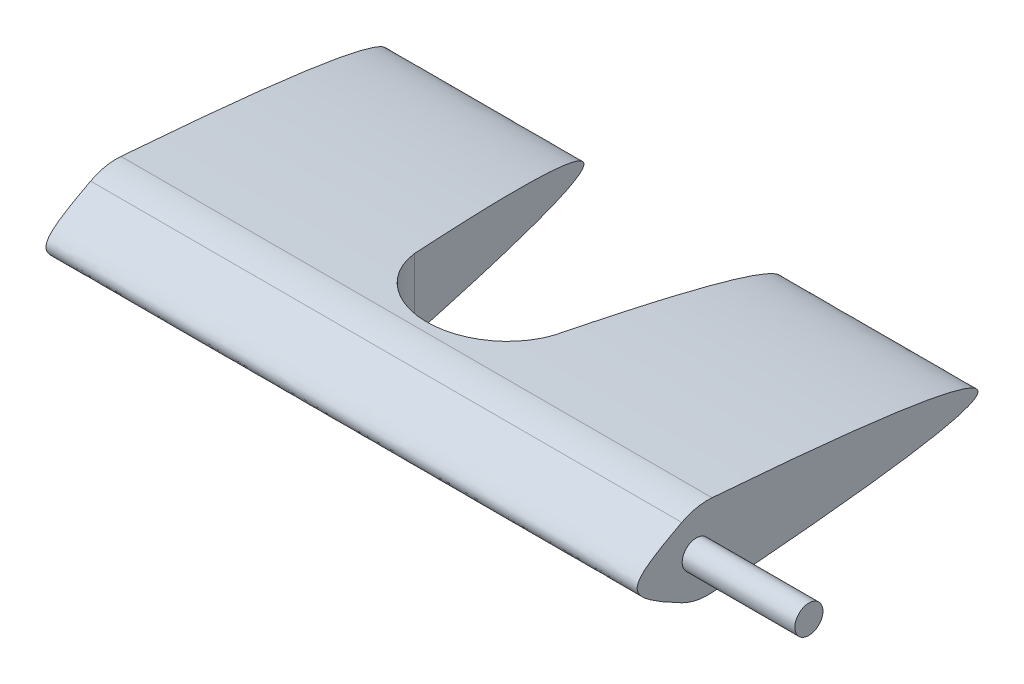
from build123d import *

# Parameters (mm, degrees)
SKETCH1_R               = 1.5
BOSS_EXTRUDE1_DEPTH     = 105
FILLET1_R               = 10
CUT_EXTRUDE1_DEPTH      = 117.542660484
CUT_EXTRUDE1_DEPTH_BACK = 117.542660484
CAVITY1_DEPTH           = 3
SKETCH3_R               = 2.5
SKETCH3_R_2             = 1.5
BOSS_EXTRUDE2_DEPTH     = 20
BOSS_EXTRUDE3_REACH     = 134.065
SKETCH4_R               = 1.5
CUT_EXTRUDE2_DEPTH      = 135.841357497
CUT_EXTRUDE2_DEPTH_BACK = 135.841357497
FILLET2_R               = 5
CUT_EXTRUDE3_DEPTH      = 10


# Read off the part's stored shape, not the designer's step: Cavity1
with BuildPart() as part:
    # Sketch1 → Boss-Extrude1 (new body)
    with BuildSketch(Plane(origin=(0, 0, 0), x_dir=(0, 0, -1), z_dir=(1, 0, 0))):
        with BuildLine():
            add(Edge.make_bspline(
                [(3.73e-07, 7.5), (-15, 0), (-3.73e-07, -7.5)],
                knots=[0, 0, 0, 1, 1, 1], degree=2, weights=[1, 2.333333333, 1]))
            add(Edge.make_bspline(
                [(3.73e-07, 7.5), (100, 0), (-3.73e-07, -7.5)],
                knots=[0, 0, 0, 1, 1, 1], degree=2, weights=[1, 1.001467765, 1]))
        make_face()
        Circle(SKETCH1_R, mode=Mode.SUBTRACT)
    extrude(amount=BOSS_EXTRUDE1_DEPTH)

    # Fillet1
    fillet1_edges = [part.edges().sort_by_distance(p)[0] for p in [
        (52.5, -7.5, 3.73e-07),
        (52.5, 7.5, -3.73e-07),
    ]]
    fillet(fillet1_edges, radius=FILLET1_R)

    # Sketch2 → Cut-Extrude1 (cut, two sides: drawn at the far end of the back side and taken through both)
    with BuildSketch(Plane(origin=(0, 0, 0), x_dir=(1, 0, 0), z_dir=(0, 1, 0)).offset(-CUT_EXTRUDE1_DEPTH_BACK)):
        with BuildLine():
            Line((65, 19.76833361), (65, 24.578179161))
            ThreePointArc((65, 24.578179161), (52.5, 34.902500415), (40, 24.578179161))
            Line((40, 24.578179161), (40, 19.76833361))
            Line((40, 19.76833361), (40, 14.958488059))
            ThreePointArc((40, 14.958488059), (52.5, 4.634166805), (65, 14.958488059))
            Line((65, 14.958488059), (65, 19.76833361))
        make_face()
        with BuildLine():
            Line((65, 24.578179161), (65, 50.03666722))
            Line((65, 50.03666722), (40, 50.03666722))
            Line((40, 50.03666722), (40, 24.578179161))
            ThreePointArc((40, 24.578179161), (52.5, 34.902500415), (65, 24.578179161))
        make_face()
    extrude(amount=CUT_EXTRUDE1_DEPTH + CUT_EXTRUDE1_DEPTH_BACK, mode=Mode.SUBTRACT)

    # Cavity1 outline → Cavity1 (cut)
    with BuildSketch(Plane.YZ):
        with BuildLine():
            ThreePointArc((-2, -13.75), (0, -15.75), (2, -13.75))
            Line((2, -13.75), (2.497863905, -2.796994085))
            ThreePointArc((2.497863905, -2.796994085), (0, 3.75), (-2.497863905, -2.796994085))
            Line((-2.497863905, -2.796994085), (-2, -13.75))
        make_face()
    extrude(amount=CAVITY1_DEPTH, mode=Mode.SUBTRACT)

    # Sketch3 → Boss-Extrude2 (add)
    # profile 1 of 2: a face of its own
    with BuildSketch(Plane(origin=(105, 0, 0), x_dir=(0, 0, -1), z_dir=(1, 0, 0))):
        Circle(SKETCH3_R)
        with Locations(Location((0, 0, 0), (0, 0, 180))):
            Circle(SKETCH3_R_2, mode=Mode.SUBTRACT)
    # profile 2 of 2: a face of its own
    with BuildSketch(Plane(origin=(105, 0, 0), x_dir=(0, 0, -1), z_dir=(1, 0, 0))):
        with Locations(Location((0, 0, 0), (0, 0, 180))):
            Circle(SKETCH3_R_2)
    extrude(amount=BOSS_EXTRUDE2_DEPTH)

    # Sketch4 → Boss-Extrude3 (add, up to next)
    with BuildSketch(Plane.ZY.offset(-3), mode=Mode.PRIVATE) as boss_extrude3_sk1:
        Circle(SKETCH4_R)
    boss_extrude3_tool1 = extrude(boss_extrude3_sk1.sketch, amount=-BOSS_EXTRUDE3_REACH, mode=Mode.PRIVATE) - part.part
    add(boss_extrude3_tool1.solids().sort_by_distance((3, 0, 0))[0])

    # Sketch5 → Cut-Extrude2 (cut, two sides: drawn at the far end of the back side and taken through both)
    with BuildSketch(Plane(origin=(0, 0, 0), x_dir=(1, 0, 0), z_dir=(0, 1, 0)).offset(-CUT_EXTRUDE2_DEPTH_BACK)):
        Polygon((40, 14.958488059), (35, 50.03666722), (40, 50.03666722), align=None)
        Polygon((65, 50.03666722), (70, 50.03666722), (65, 14.958488059), align=None)
    extrude(amount=CUT_EXTRUDE2_DEPTH + CUT_EXTRUDE2_DEPTH_BACK, mode=Mode.SUBTRACT)

    # Fillet2
    fillet2_edges = [part.edges().sort_by_distance(p)[0] for p in [
        (1.5, 2.497863905, -2.796994085),
        (1.5, -2.497863905, -2.796994085),
    ]]
    fillet(fillet2_edges, radius=FILLET2_R)

    # Sketch7 → Cut-Extrude3 (cut)
    with BuildSketch(Plane.ZY.offset(-3)):
        with BuildLine():
            Line((-13.754651281, -2.199995083), (-4.420599378, -2.62427017))
            ThreePointArc((-4.420599378, -2.62427017), (-3.210509972, -2.836668826), (-2.093976777, -3.349292651))
            ThreePointArc((-2.093976777, -3.349292651), (3.95, 0), (-2.093976777, 3.349292651))
            ThreePointArc((-2.093976777, 3.349292651), (-3.210509972, 2.836668826), (-4.420599378, 2.62427017))
            Line((-4.420599378, 2.62427017), (-13.754651281, 2.199995083))
            ThreePointArc((-13.754651281, 2.199995083), (-15.95, 0), (-13.754651281, -2.199995083))
        make_face()
        with BuildLine():
            Line((-4.411517846, 2.424476462), (-13.75, 2))
            ThreePointArc((-13.75, 2), (-15.75, 0), (-13.75, -2))
            Line((-13.75, -2), (-4.411517846, -2.424476462))
            ThreePointArc((-4.411517846, -2.424476462), (-3.151008047, -2.645725062), (-1.987952636, -3.179708213))
            ThreePointArc((-1.987952636, -3.179708213), (3.75, 0), (-1.987952636, 3.179708213))
            ThreePointArc((-1.987952636, 3.179708213), (-3.151008047, 2.645725062), (-4.411517846, 2.424476462))
        make_face(mode=Mode.SUBTRACT)
    extrude(amount=CUT_EXTRUDE3_DEPTH, mode=Mode.SUBTRACT)


solid = part.part
